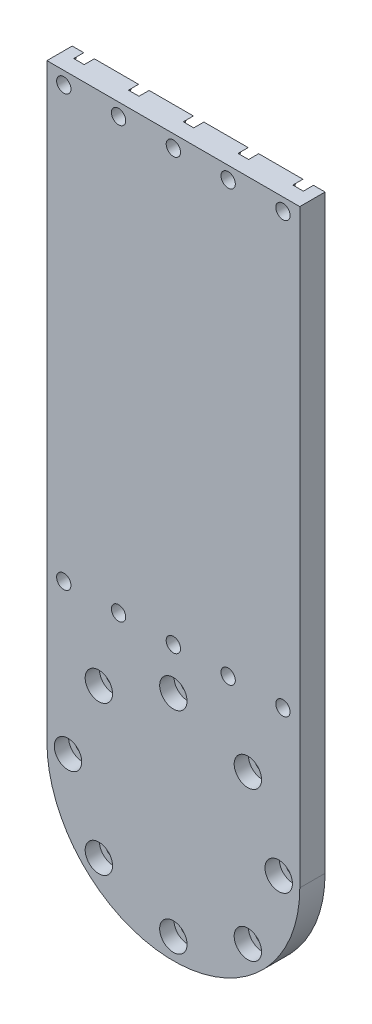
from build123d import *

# Parameters (mm, degrees)
BOSS_EXTRUDE1_DEPTH                                  = 6
CBORE_FOR_M3_HEX_SOCKET_HEAD_CAP_SCREW1_D            = 3.4
CBORE_FOR_M3_HEX_SOCKET_HEAD_CAP_SCREW1_CBORE_D      = 6.5
CBORE_FOR_M3_HEX_SOCKET_HEAD_CAP_SCREW1_CBORE_DEPTH  = 3.4
CBORE_FOR_M3_HEX_SOCKET_THIN_HEAD_CAP_SC_D           = 3.4
CBORE_FOR_M3_HEX_SOCKET_THIN_HEAD_CAP_SC_DEPTH       = 10
CBORE_FOR_M3_HEX_SOCKET_THIN_HEAD_CAP_SC_CBORE_D     = 6.5
CBORE_FOR_M3_HEX_SOCKET_THIN_HEAD_CAP_SC_CBORE_DEPTH = 2.4
CBORE_FOR_M3_HEX_SOCKET_THIN_HEAD_CAP_SC_TIP         = 1.021463052


with BuildPart() as part:
    # Sketch1 → Boss-Extrude1 (new body)
    with BuildSketch(Plane.XY):
        with BuildLine():
            Line((-30, 0), (-30, 140))
            Line((-30, 140), (30, 140))
            Line((30, 140), (30, 0))
            ThreePointArc((30, 0), (0, -30), (-30, 0))
        make_face()
    extrude(amount=BOSS_EXTRUDE1_DEPTH)

    # CBORE for M3 Hex Socket Head Cap Screw1 (through all)
    with Locations(Plane.XY.offset(6)):
        with Locations((-17.67766953, 17.67766953), (0, 25), (17.67766953, 17.67766953), (25, 0), (17.67766953, -17.67766953), (0, -25), (-17.67766953, -17.67766953), (-25, 0)):
            CounterBoreHole(CBORE_FOR_M3_HEX_SOCKET_HEAD_CAP_SCREW1_D / 2, CBORE_FOR_M3_HEX_SOCKET_HEAD_CAP_SCREW1_CBORE_D / 2, CBORE_FOR_M3_HEX_SOCKET_HEAD_CAP_SCREW1_CBORE_DEPTH)

    # CBORE for M3 Hex Socket Thin Head Cap Screw1
    with Locations(Plane(origin=(0, 0, 0), x_dir=(-1, 0, 0), z_dir=(0, 0, -1))):
        with Locations((-26, 137), (0, 35), (13, 35), (26, 35), (-13, 35), (-26, 35), (0, 137), (13, 137), (26, 137), (-13, 137)):
            CounterBoreHole(CBORE_FOR_M3_HEX_SOCKET_THIN_HEAD_CAP_SC_D / 2, CBORE_FOR_M3_HEX_SOCKET_THIN_HEAD_CAP_SC_CBORE_D / 2, CBORE_FOR_M3_HEX_SOCKET_THIN_HEAD_CAP_SC_CBORE_DEPTH, depth=CBORE_FOR_M3_HEX_SOCKET_THIN_HEAD_CAP_SC_DEPTH)
            with Locations((0, 0, -(CBORE_FOR_M3_HEX_SOCKET_THIN_HEAD_CAP_SC_DEPTH + CBORE_FOR_M3_HEX_SOCKET_THIN_HEAD_CAP_SC_TIP / 2))):  # 118° drill point
                Cone(0, CBORE_FOR_M3_HEX_SOCKET_THIN_HEAD_CAP_SC_D / 2, CBORE_FOR_M3_HEX_SOCKET_THIN_HEAD_CAP_SC_TIP, mode=Mode.SUBTRACT)


solid = part.part
